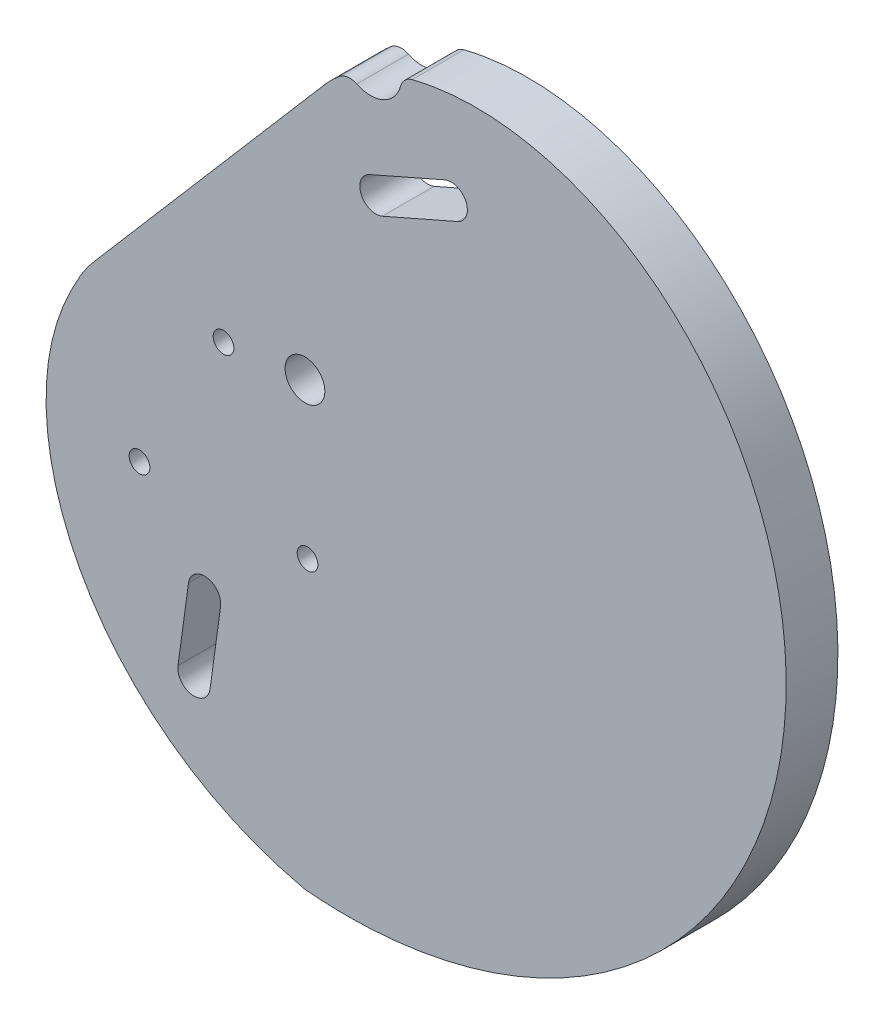
from build123d import *

# Parameters (mm, degrees)
SKETCH1_R               = 3.075
BOSS_EXTRUDE1_DEPTH     = 4
CUT_EXTRUDE1_DEPTH      = 102.23786292
CUT_EXTRUDE1_DEPTH_BACK = 102.23786292
FILLET1_START           = -5
FILLET1_DEPTH           = 10
M4X0_7_TAPPED_HOLE1_D   = 3.2
FILLET2_R               = 2.5
CUT_EXTRUDE2_DEPTH      = 10


with BuildPart() as part:
    # Sketch1 → Boss-Extrude1 (new, symmetric)
    with BuildSketch(Plane.XY):
        with BuildLine():
            ThreePointArc((14.94525387, 48.021771818), (12.07211231, 43.542786085), (6.824607964, 44.425935993))
            add(Edge.make_bspline(
                [(6.824607964, 44.425935993), (6.611166223, 44.297424266), (6.111085767, 43.988924875), (5.336928158, 43.48349234), (4.507353656, 42.905954051), (3.699024971, 42.306520427), (2.912619563, 41.685826384), (2.149082762, 41.044776761), (1.408732666, 40.385653153), (0.69201842, 39.710962437), (-0.000702823, 39.023274092), (-0.669224606, 38.325164066), (-1.313490613, 37.619209289), (-1.933594741, 36.907981167), (-2.529780734, 36.194039342), (-3.102441662, 35.479925366), (-3.652119172, 34.768156406), (-4.179502537, 34.061218936), (-4.68542751, 33.361562432), (-5.170874981, 32.671593072), (-5.636969475, 31.993667421), (-6.084977486, 31.330086125), (-6.5163057, 30.68308757), (-6.932499191, 30.054841594), (-7.335239472, 29.447442991), (-7.726343211, 28.862905788), (-8.107759261, 28.30315506), (-8.481572996, 27.770028153), (-8.850055929, 27.265150233), (-9.21599154, 26.789707359), (-9.58007402, 26.342396401), (-9.943199031, 25.921274986), (-10.306211946, 25.524302901), (-10.669815304, 25.149428396), (-11.03457423, 24.794597749), (-11.400917427, 24.457759077), (-11.769139802, 24.136868148), (-12.139404915, 23.829894257), (-12.511747444, 23.534826559), (-12.886075425, 23.249680558), (-13.262172288, 22.972504592), (-13.639698706, 22.701386132), (-14.018194373, 22.4344578), (-14.397079826, 22.169903041), (-14.775658393, 21.905961469), (-15.153118349, 21.640933911), (-15.528535328, 21.37318718), (-15.900874865, 21.101158728), (-16.268995598, 20.823360748), (-16.631651048, 20.538385549), (-16.987497448, 20.244905703), (-17.335071725, 19.941700072), (-17.674482118, 19.629485326), (-18.005889299, 19.308945872), (-18.329486913, 18.98074786), (-18.645506177, 18.6455329), (-18.954213469, 18.303917657), (-19.255909475, 17.956492143), (-19.550927855, 17.603818409), (-19.839633983, 17.246429189), (-20.122423608, 16.884826615), (-20.39972148, 16.519480973), (-20.671979932, 16.15082951), (-20.93967742, 15.77927529), (-21.203317027, 15.405186109), (-21.463424922, 15.028893458), (-21.720548787, 14.650691546), (-21.975256201, 14.270836377), (-22.228133, 13.889544888), (-22.479781587, 13.506994147), (-22.730819224, 13.123320602), (-22.981876279, 12.738619403), (-23.233594452, 12.35294377), (-23.486624965, 11.966304432), (-23.741626724, 11.578669117), (-23.999264462, 11.189962103), (-24.260206854, 10.800063825), (-24.52512461, 10.408810538), (-24.794688561, 10.015994037), (-25.069567717, 9.621361426), (-25.350427363, 9.224614974), (-25.637926993, 8.8254119), (-25.932718851, 8.423364715), (-26.235444149, 8.018039723), (-26.546738212, 7.608962846), (-26.867193334, 7.195608336), (-27.197393741, 6.777566684), (-27.537037782, 6.353934602), (-27.885559202, 5.923803469), (-28.242374703, 5.486366009), (-28.606855737, 5.040842301), (-28.978345064, 4.586492757), (-29.356154138, 4.122615768), (-29.739565815, 3.648549546), (-30.127835637, 3.163672741), (-30.520193566, 2.667405334), (-30.915845631, 2.159209384), (-31.313975642, 1.638589743), (-31.713746908, 1.10509472), (-32.114303997, 0.558316687), (-32.514774496, -0.002107372), (-32.914270801, -0.576495363), (-33.311891916, -1.165119646), (-33.70672526, -1.768206653), (-34.097848491, -2.385936568), (-34.484331334, -3.01844306), (-34.865237414, -3.665813085), (-35.239626095, -4.328086735), (-35.606554319, -5.00525716), (-35.965078448, -5.697270543), (-36.314256102, -6.404026134), (-36.653147994, -7.125376348), (-36.98081976, -7.861126926), (-37.296343783, -8.611037148), (-37.598801011, -9.374820113), (-37.887282738, -10.15214308), (-38.160892488, -10.942627847), (-38.418747446, -11.745851279), (-38.659981522, -12.561345551), (-38.883742182, -13.388599746), (-39.089211497, -14.227059816), (-39.27554787, -15.076191303), (-39.442240692, -15.935443066), (-39.58900499, -16.804297383), (-39.715531283, -17.682274795), (-39.821534024, -18.56888584), (-39.906736403, -19.463633732), (-39.970874682, -20.366013757), (-40.01369729, -21.27551381), (-40.034965324, -22.191614638), (-40.034452659, -23.113790166), (-40.011946156, -24.041507803), (-39.967245835, -24.974228766), (-39.900165044, -25.911408403), (-39.810530622, -26.852496518), (-39.698183052, -27.796937709), (-39.56297661, -28.744171699), (-39.4047795, -29.693633681), (-39.223473982, -30.64475466), (-39.018956498, -31.596961802), (-38.791137779, -32.549678783), (-38.539942955, -33.502326148), (-38.265311644, -34.454321664), (-37.967198044, -35.405080681), (-37.645571006, -36.354016496), (-37.300414107, -37.300540716), (-36.931725709, -38.244063627), (-36.539519007, -39.18399456), (-36.123822074, -40.119742265), (-35.684677893, -41.050715279), (-35.222144381, -41.976322302), (-34.736294403, -42.89597257), (-34.227215775, -43.809076229), (-33.695011264, -44.715044715), (-33.139798572, -45.613291121), (-32.561710315, -46.503230581), (-31.960893988, -47.384280643), (-31.337511928, -48.255861642), (-30.69174126, -49.117397078), (-30.023773839, -49.96831399), (-29.333816181, -50.808043326), (-28.622089382, -51.636020317), (-27.888829033, -52.451684847), (-27.134285123, -53.25448182), (-26.358721931, -54.04386153), (-25.562417912, -54.819280022), (-24.745665571, -55.580199454), (-23.908771332, -56.326088459), (-23.052055394, -57.0564225), (-22.175851579, -57.770684224), (-21.280507172, -58.468363812), (-20.366382752, -59.148959324), (-19.433852012, -59.811977048), (-18.483301577, -60.456931829), (-17.515130802, -61.083347415), (-16.529751575, -61.690756781), (-15.527588097, -62.278702456), (-14.50907667, -62.846736843), (-13.474665463, -63.39442255), (-12.424814268, -63.921332635), (-11.359994294, -64.427051169), (-10.280687768, -64.911172569), (-9.187388219, -65.373305515), (-8.080598179, -65.813059652), (-6.960836498, -66.230096831), (-5.828609627, -66.623940268), (-4.684517934, -66.994691537), (-3.528855652, -67.340343195), (-2.3631095, -67.666856553), (-1.184338477, -67.950378607), (-0.400093515, -68.169065005), (0, -68.230921715)],
                knots=[0.585132093, 0.585132093, 0.585132093, 0.585132093, 0.58720527, 0.590021199, 0.59282457, 0.59561552, 0.598394199, 0.601160164, 0.603910525, 0.606641733, 0.609350191, 0.612032273, 0.614684334, 0.617302722, 0.619883791, 0.622423916, 0.624919509, 0.627367038, 0.629763043, 0.632104166, 0.634387177, 0.636609005, 0.638766786, 0.640857908, 0.642880081, 0.644831406, 0.646710483, 0.648516525, 0.650249514, 0.65191136, 0.653508519, 0.655048349, 0.65653798, 0.657984241, 0.659393583, 0.66077201, 0.662125022, 0.663457568, 0.664774018, 0.666078151, 0.667373165, 0.668661696, 0.669945853, 0.671227263, 0.672507127, 0.673786273, 0.67506522, 0.676344239, 0.677623416, 0.678902717, 0.68018205, 0.681461324, 0.682740438, 0.684019262, 0.685297659, 0.686575488, 0.687852615, 0.689128915, 0.690404281, 0.691678632, 0.692951916, 0.694224122, 0.695495279, 0.696765474, 0.698034846, 0.699303605, 0.70057203, 0.70184048, 0.703109399, 0.704379325, 0.705650892, 0.706924838, 0.708202013, 0.709483377, 0.710770009, 0.712063109, 0.713363997, 0.714674119, 0.715995039, 0.717328447, 0.718676146, 0.720040056, 0.721422204, 0.722824718, 0.724249822, 0.725699824, 0.727177002, 0.72868281, 0.730218172, 0.731783831, 0.733380363, 0.735008197, 0.736667628, 0.738358831, 0.740081872, 0.741836722, 0.743623264, 0.745441305, 0.747290584, 0.749170776, 0.751081502, 0.753022336, 0.754992805, 0.756992401, 0.759020578, 0.761076761, 0.763160347, 0.76527071, 0.767407202, 0.769569155, 0.771755887, 0.7739667, 0.776200882, 0.778457713, 0.780736462, 0.783036392, 0.785356757, 0.787696808, 0.790055792, 0.792432952, 0.794827532, 0.797238799, 0.799666426, 0.802110394, 0.804570687, 0.807047284, 0.809540165, 0.812049305, 0.814574675, 0.817116246, 0.819673984, 0.822247852, 0.824837811, 0.82744382, 0.830065834, 0.832703806, 0.835357687, 0.838027424, 0.840712962, 0.843414244, 0.84613121, 0.848863798, 0.851611942, 0.854375576, 0.857154631, 0.859949033, 0.862758708, 0.865583582, 0.868423573, 0.871278601, 0.874148584, 0.877033434, 0.879933066, 0.882847387, 0.885776307, 0.888719732, 0.891677564, 0.894649707, 0.897636058, 0.900636516, 0.903650977, 0.906679333, 0.909721476, 0.912777297, 0.915846682, 0.918929518, 0.922025687, 0.925135072, 0.928257554, 0.931393009, 0.934541315, 0.937702347, 0.940875975, 0.944062073, 0.947260508, 0.950471149, 0.95369386, 0.956928506, 0.960174949, 0.96343305, 0.966702667, 0.969983657, 0.973275876, 0.976579178, 0.979893415, 0.983218438, 0.986554095, 0.989900235, 0.993256703, 0.996623344, 1, 1, 1, 1], degree=3))
            add(Edge.make_bspline(
                [(0, -68.230921715), (0.393333706, -68.291733321), (1.194961176, -68.321276753), (2.388868431, -68.414811628), (3.58891617, -68.470136134), (4.791044831, -68.510535556), (5.995946289, -68.52954927), (7.203026535, -68.528713614), (8.412027616, -68.507423129), (9.62259203, -68.465654591), (10.83437986, -68.403235569), (12.047037443, -68.320041284), (13.260205927, -68.215942066), (14.473519127, -68.090817818), (15.686604264, -67.944554476), (16.899081946, -67.777045295), (18.110566359, -67.588190842), (19.320665416, -67.377899329), (20.528980925, -67.146086849), (21.73510877, -66.892677633), (22.938639087, -66.6176043), (24.139156466, -66.320808097), (25.336240146, -66.002239142), (26.529464226, -65.661856654), (27.718397887, -65.299629187), (28.90260561, -64.915534847), (30.081647414, -64.509561514), (31.255079097, -64.081707052), (32.42245248, -63.631979515), (33.58331567, -63.160397343), (34.737213315, -62.666989561), (35.883686879, -62.151795956), (37.022274916, -61.614867262), (38.152513354, -61.056265327), (39.273935784, -60.476063279), (40.386073758, -59.87434568), (41.488457085, -59.251208675), (42.580614147, -58.606760131), (43.662072205, -57.941119771), (44.732357722, -57.254419292), (45.790996682, -56.546802486), (46.837514925, -55.81842534), (47.871438475, -55.069456136), (48.89229388, -54.300075538), (49.899608554, -53.51047667), (50.892911122, -52.700865183), (51.871731772, -51.87145932), (52.835602603, -51.022489959), (53.784057989, -50.154200657), (54.71663493, -49.26684768), (55.632873421, -48.360700021), (56.532316811, -47.436039411), (57.414512174, -46.493160317), (58.279010671, -45.532369935), (59.125367928, -44.553988165), (59.953144401, -43.558347582), (60.761905749, -42.545793391), (61.55122321, -41.516683378), (62.320673971, -40.471387842), (63.069841543, -39.410289525), (63.798316132, -38.333783527), (64.505695017, -37.242277204), (65.191582915, -36.13619007), (65.85559236, -35.015953676), (66.497344063, -33.882011479), (67.11646729, -32.734818707), (67.71260022, -31.574842209), (68.285390316, -30.402560293), (68.834494677, -29.218462553), (69.359580408, -28.023049692), (69.860324965, -26.816833323), (70.336416512, -25.60033577), (70.787554269, -24.374089852), (71.213448854, -23.13863866), (71.613822626, -21.894535318), (71.988410015, -20.642342743), (72.336957858, -19.382633384), (72.659225719, -18.115988959), (72.954986211, -16.843000179), (73.224025309, -15.564266461), (73.466142659, -14.28039563), (73.681151874, -12.992003617), (73.868880836, -11.699714142), (74.029171977, -10.404158388), (74.161882563, -9.10597467), (74.266884966, -7.805808087), (74.344066927, -6.504310174), (74.393331816, -5.202138538), (74.414598879, -3.89995649), (74.407803478, -2.598432666), (74.372897323, -1.29824064), (74.309848696, -5.853e-05), (74.218642658, 1.295431404), (74.099281259, 2.587543173), (73.95178373, 3.875587471), (73.776186663, 5.158872107), (73.572544188, 6.43670243), (73.340928136, 7.708381771), (73.081428188, 8.973211889), (72.794152019, 10.230493418), (72.47922543, 11.479526328), (72.13679246, 12.719610386), (71.767015501, 13.950045625), (71.37007539, 15.170132817), (70.946171493, 16.379173951), (70.495521777, 17.576472716), (70.018362872, 18.761334989), (69.514950114, 19.933069325), (68.985557583, 21.090987453), (68.430478125, 22.234404772), (67.850023359, 23.362640855), (67.244523678, 24.47501995), (66.614328227, 25.570871489), (65.959804877, 26.649530597), (65.281340181, 27.710338599), (64.579339317, 28.752643533), (63.85422602, 29.775800665), (63.106442497, 30.779173), (62.33644933, 31.762131799), (61.544725366, 32.724057086), (60.731767601, 33.66433818), (59.898090995, 34.582374149), (59.044228508, 35.477574541), (58.170730235, 36.349359075), (57.278166357, 37.197160694), (56.367121668, 38.020410915), (55.438270074, 38.818621759), (54.492318121, 39.591335254), (53.529982536, 40.3381068), (52.551992493, 41.058512637), (51.559087829, 41.752148676), (50.552018856, 42.418631155), (49.531545735, 43.057596786), (48.498437965, 43.668703015), (47.453473832, 44.251628246), (46.397439863, 44.806072049), (45.331130274, 45.331755356), (44.255346411, 45.828420647), (43.17089619, 46.295832116), (42.078593533, 46.733775825), (40.979257798, 47.142059848), (39.873713209, 47.520514394), (38.762788284, 47.868991924), (37.647315256, 48.187367242), (36.528129497, 48.475537585), (35.406068937, 48.733422689), (34.281973488, 48.960964845), (33.156684455, 49.158128938), (32.031043959, 49.324902476), (30.905894352, 49.461295599), (29.78207764, 49.567341079), (28.66043489, 49.643094299), (27.541805663, 49.688633226), (26.427027423, 49.704058363), (25.316934962, 49.689492689), (24.212359828, 49.645081585), (23.114129743, 49.570992746), (22.023068037, 49.46741608), (20.939993076, 49.334563587), (19.865717696, 49.172669234), (18.801048645, 48.981988806), (17.746786017, 48.762799751), (16.703722704, 48.515401007), (15.7707146, 48.26629677), (15.186932522, 48.095241394), (14.94525387, 48.021771818)],
                knots=[0, 0, 0, 0, 0.003319606, 0.00664483, 0.00997572, 0.013312315, 0.016654652, 0.020002764, 0.023356679, 0.026716422, 0.030082012, 0.033453467, 0.036830797, 0.040214011, 0.043603114, 0.046998106, 0.050398984, 0.05380574, 0.057218364, 0.060636841, 0.064061153, 0.067491279, 0.070927192, 0.074368865, 0.077816264, 0.081269354, 0.084728096, 0.088192446, 0.09166236, 0.095137787, 0.098618675, 0.102104968, 0.105596607, 0.10909353, 0.112595671, 0.116102963, 0.119615332, 0.123132706, 0.126655005, 0.130182149, 0.133714056, 0.137250637, 0.140791804, 0.144337465, 0.147887524, 0.151441884, 0.155000443, 0.158563099, 0.162129745, 0.165700272, 0.169274569, 0.172852522, 0.176434014, 0.180018926, 0.183607137, 0.187198521, 0.190792953, 0.194390304, 0.197990441, 0.201593231, 0.205198539, 0.208806224, 0.212416148, 0.216028167, 0.219642135, 0.223257906, 0.226875331, 0.230494258, 0.234114533, 0.237736001, 0.241358506, 0.244981886, 0.248605983, 0.252230632, 0.255855669, 0.259480928, 0.263106241, 0.266731437, 0.270356345, 0.273980794, 0.277604607, 0.281227611, 0.284849627, 0.288470478, 0.292089983, 0.295707963, 0.299324234, 0.302938615, 0.306550921, 0.310160967, 0.313768569, 0.317373538, 0.320975689, 0.324574833, 0.328170782, 0.331763348, 0.335352341, 0.338937573, 0.342518853, 0.346095993, 0.349668803, 0.353237093, 0.356800674, 0.360359359, 0.363912958, 0.367461284, 0.37100415, 0.37454137, 0.37807276, 0.381598135, 0.385117313, 0.388630113, 0.392136355, 0.395635862, 0.399128458, 0.402613969, 0.406092224, 0.409563054, 0.413026294, 0.416481778, 0.419929348, 0.423368847, 0.426800121, 0.43022302, 0.4336374, 0.437043112, 0.440439966, 0.443827754, 0.447206268, 0.450575308, 0.453934675, 0.457284173, 0.460623612, 0.463952804, 0.467271567, 0.470579721, 0.473877092, 0.477163509, 0.480438807, 0.483702825, 0.486955407, 0.490196401, 0.493425661, 0.496643048, 0.499848424, 0.50304166, 0.506222633, 0.509391223, 0.512547319, 0.515690814, 0.518821608, 0.521939609, 0.52504473, 0.528136891, 0.531216019, 0.53428205, 0.537334925, 0.540374595, 0.543401017, 0.546414157, 0.549413988, 0.552400493, 0.555373664, 0.5583335, 0.560435437, 0.560435437, 0.560435437, 0.560435437], degree=3))
        make_face()
        Circle(SKETCH1_R, mode=Mode.SUBTRACT)
        with BuildLine():
            ThreePointArc((11.984914181, 27.895733584), (8.691133377, 29.180649151), (9.976048944, 32.474429955))
            Line((9.976048944, 32.474429955), (21.605937727, 37.576947657))
            ThreePointArc((21.605937727, 37.576947657), (24.899718531, 36.29203209), (23.614802964, 32.998251286))
            Line((23.614802964, 32.998251286), (11.984914181, 27.895733584))
        make_face(mode=Mode.SUBTRACT)
    extrude(amount=BOSS_EXTRUDE1_DEPTH, both=True)

    # Sketch2 → Cut-Extrude1 (cut, two sides: drawn at the far end of the back side and taken through both)
    with BuildSketch(Plane.XY.offset(-CUT_EXTRUDE1_DEPTH_BACK)):
        Polygon((4.833037594, 43.130944449), (-33.665262713, -1.70731465), (-6.861868576, 43.130944449), align=None)
    extrude(amount=CUT_EXTRUDE1_DEPTH + CUT_EXTRUDE1_DEPTH_BACK, mode=Mode.SUBTRACT)

    # Fillet1: read off the stored shape, not the designer's step
    # Fillet1 outline → Fillet1 (cut)
    with BuildSketch(Plane.XY.offset(FILLET1_START)):
        with BuildLine():
            add(Edge.make_bspline(
                [(-33.665262713, -1.70731465), (-33.677962215, -1.726972467), (-33.822754696, -1.951460543), (-34.097848491, -2.385936568), (-34.447383574, -2.957975438), (-34.664608399, -3.325164923), (-34.755069569, -3.480236719)],
                knots=[0.756797653, 0.756797653, 0.756797653, 0.756797653, 0.756992401, 0.759020578, 0.761076761, 0.762570691, 0.762570691, 0.762570691, 0.762570691], degree=3))
            ThreePointArc((-34.755069569, -3.480236719), (-33.771382384, -1.957080562), (-32.653791354, -0.529272646))
            Line((-32.653791354, -0.529272646), (-33.665262713, -1.70731465))
        make_face()
        with BuildLine():
            Line((4.833037545, 43.130944414), (2.980542079, 40.973377148))
            ThreePointArc((2.980542079, 40.973377148), (4.790611786, 42.824316011), (6.824607964, 44.425935993))
            add(Edge.make_bspline(
                [(6.824607964, 44.425935993), (6.611166223, 44.297424266), (6.111085767, 43.988924875), (5.447825127, 43.555894827), (5.000467699, 43.248311471), (4.833037545, 43.130944414)],
                knots=[0.585132093, 0.585132093, 0.585132093, 0.585132093, 0.58720527, 0.590021199, 0.591722633, 0.591722633, 0.591722633, 0.591722633], degree=3))
        make_face()
    extrude(amount=FILLET1_DEPTH, mode=Mode.SUBTRACT)

    # M4x0.7 Tapped Hole1 (through all)
    with Locations(Plane.XY.offset(4)):
        with Locations((-12.593900177, -1.272585975), (0.396480879, -23.772585975), (-25.584281234, -23.772585975)):
            Hole(M4X0_7_TAPPED_HOLE1_D / 2)

    # Fillet2
    fillet2_edges = [part.edges().sort_by_distance(p)[0] for p in [
        (14.94525387, 48.021771818, -2),
        (6.824607964, 44.425935993, 0),
    ]]
    fillet(fillet2_edges, radius=FILLET2_R)

    # Sketch6 → Cut-Extrude2 (cut)
    with BuildSketch(Plane.XY.offset(4)):
        with BuildLine():
            Line((-13.045399083, -36.881857394), (-14.675196725, -48.770665562))
            ThreePointArc((-14.675196725, -48.770665562), (-17.494325783, -50.910048505), (-19.633708727, -48.090919447))
            Line((-19.633708727, -48.090919447), (-18.003911085, -36.202111279))
            ThreePointArc((-18.003911085, -36.202111279), (-15.184782027, -34.062728336), (-13.045399083, -36.881857394))
        make_face()
    extrude(amount=-CUT_EXTRUDE2_DEPTH, mode=Mode.SUBTRACT)


solid = part.part
